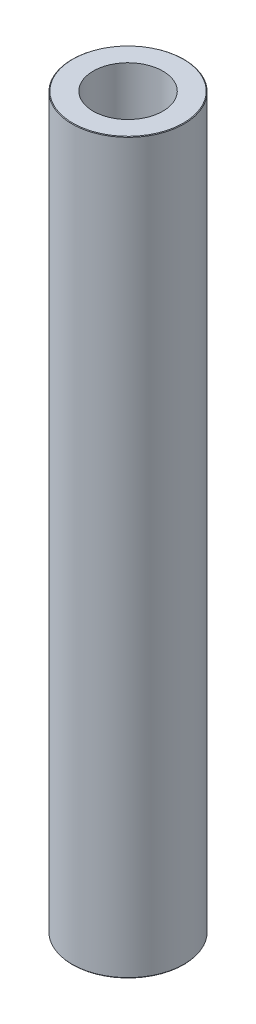
from build123d import *
from OCP.BRepFilletAPI import BRepFilletAPI_MakeChamfer

# Parameters (mm, degrees)
SKETCH1_R           = 35
BOSS_EXTRUDE1_DEPTH = 455.618633308
SKETCH2_R           = 21.767278951
CUT_EXTRUDE1_DEPTH  = 459.299398884
CHAMFER1_SIZE       = 0.307996207
CHAMFER1_SIZE2      = 0.410022418


with BuildPart() as part:
    # Sketch1 → Boss-Extrude1 (new body)
    with BuildSketch(Plane(origin=(0, 0, 0), x_dir=(1, 0, 0), z_dir=(0, 1, 0))):
        Circle(SKETCH1_R)
    extrude(amount=BOSS_EXTRUDE1_DEPTH)

    # Sketch2 → Cut-Extrude1 (cut, through all)
    with BuildSketch(Plane(origin=(0, 0, 0), x_dir=(1, 0, 0), z_dir=(0, 1, 0))):
        Circle(SKETCH2_R)
    extrude(amount=CUT_EXTRUDE1_DEPTH, mode=Mode.SUBTRACT)

    # Chamfer1: one chamfer whose edges measure the first distance from different faces: ONE call of the kernel's chamfer builder (chamfer() names one face for all edges)
    chamfer1_edges_1 = [part.edges().sort_by_distance(p)[0] for p in [
        (-35, 455.618633308, 0),
    ]]
    chamfer1_side_1 = [part.faces().sort_by_distance(p)[0] for p in [
        (-35, 227.809316654, 0),
    ]]
    chamfer1_edges_2 = [part.edges().sort_by_distance(p)[0] for p in [
        (-35, 0, 0),
    ]]
    chamfer1_side_2 = [part.faces().sort_by_distance(p)[0] for p in [
        (-34.010050506, 0, 0),
    ]]
    chamfer1 = BRepFilletAPI_MakeChamfer(part.part.solid().wrapped)
    for e in chamfer1_edges_1:
        chamfer1.Add(CHAMFER1_SIZE, CHAMFER1_SIZE2, e.wrapped, chamfer1_side_1[0].wrapped)  # the first distance lies on this face
    for e in chamfer1_edges_2:
        chamfer1.Add(CHAMFER1_SIZE, CHAMFER1_SIZE2, e.wrapped, chamfer1_side_2[0].wrapped)  # the first distance lies on this face
    add(Compound.cast(chamfer1.Shape()), mode=Mode.REPLACE)


solid = part.part
